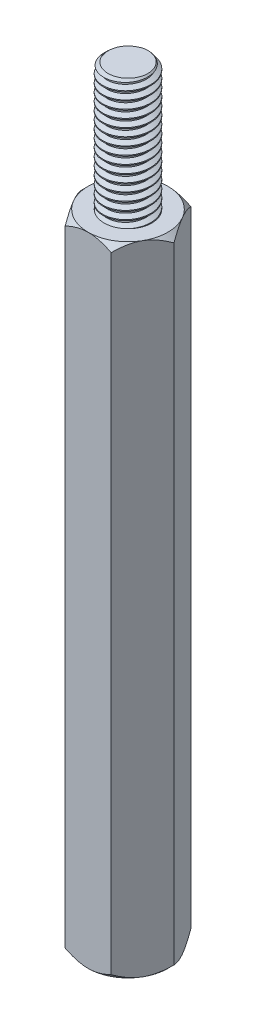
from build123d import *

# Parameters (mm, degrees)
ADJUSTABLE_HEIGHT_DEPTH      = 20
ADJUSTABLE_HEIGHT_DEPTH_BACK = 20
TROU_TARAUD_M31_D            = 2.5
TROU_TARAUD_M31_DEPTH        = 20
TROU_TARAUD_M31_CSINK_D      = 3.5
TROU_TARAUD_M31_CSINK_ANGLE  = 90
TROU_TARAUD_M31_TIP          = 0.751075774
ESQUISSE6_R                  = 1.5
BOSS_EXTRU_1_DEPTH           = 8
CHANFREIN1_SIZE              = 0.25
FILETAGE3_PITCH              = 0.5


with BuildPart() as part:
    # Esquisse1 → Adjustable height (new, two sides: drawn at the far end of the back side and taken through both)
    with BuildSketch(Plane(origin=(0, 0, 0), x_dir=(1, 0, 0), z_dir=(0, 1, 0)).offset(-ADJUSTABLE_HEIGHT_DEPTH_BACK)):
        Polygon((-2.886751346, 0), (-1.443375673, -2.5), (1.443375673, -2.5), (2.886751346, 0), (1.443375673, 2.5), (-1.443375673, 2.5), align=None)
    extrude(amount=ADJUSTABLE_HEIGHT_DEPTH + ADJUSTABLE_HEIGHT_DEPTH_BACK)

    # Trou taraudé M31
    with Locations(Plane(origin=(0, -20, 0), x_dir=(-1, 0, 0), z_dir=(0, -1, 0))):
        with Locations((0, 0)):
            CounterSinkHole(TROU_TARAUD_M31_D / 2, TROU_TARAUD_M31_CSINK_D / 2, depth=TROU_TARAUD_M31_DEPTH, counter_sink_angle=TROU_TARAUD_M31_CSINK_ANGLE)
            with Locations((0, 0, -(TROU_TARAUD_M31_DEPTH + TROU_TARAUD_M31_TIP / 2))):  # 118° drill point
                Cone(0, TROU_TARAUD_M31_D / 2, TROU_TARAUD_M31_TIP, mode=Mode.SUBTRACT)

    # Esquisse5 → Enlèvement de matière-Révolution1 (revolve, cut)
    with BuildSketch(Plane(origin=(0, 0, 0), x_dir=(0, 0, -1), z_dir=(1, 0, 0)), mode=Mode.PRIVATE) as enl_vement_de_mati_re_r_volution1_sk:
        Polygon((-2.5, 20), (-3.5, 19), (-3.5, 20), align=None)
        Polygon((-3.5, -19), (-3.5, -20), (-2.5, -20), align=None)
    revolve(enl_vement_de_mati_re_r_volution1_sk.sketch.rotate(Axis((0, 23.826611975, 0), (0, -1, 0)), 180), axis=Axis((0, 23.826611975, 0), (0, -1, 0)), mode=Mode.SUBTRACT)

    # Esquisse6 → Boss.-Extru.1 (add)
    with BuildSketch(Plane(origin=(0, 20, 0), x_dir=(1, 0, 0), z_dir=(0, 1, 0))):
        with Locations(Location((0, 0, 0), (0, 0, 270))):
            Circle(ESQUISSE6_R)
    extrude(amount=BOSS_EXTRU_1_DEPTH)

    # Chanfrein1
    chanfrein1_edges = [part.edges().sort_by_distance(p)[0] for p in [
        (0, 28, -1.5),
    ]]
    chamfer(chanfrein1_edges, length=CHANFREIN1_SIZE)

    # Filetage3: the profile of Profil de filetage6 profile screwed along a right-hand helix of 17 turns, 6 arcs to a turn; built about Z, then put on its axis
    filetage3_z = Axis((0, 0, 0), (0, 0, 1))
    filetage3_corners = [(1.5003, 0, -0.000173205), (1.5003, 0, 0.437673204), (1.229367063, 0, 0.281249999), (1.229367063, 0, 0.156249999)]
    with BuildLine(mode=Mode.PRIVATE) as filetage3_profile:
        Line(filetage3_corners[0], filetage3_corners[1])
        Line(filetage3_corners[1], filetage3_corners[2])
        Line(filetage3_corners[2], filetage3_corners[3])
        Line(filetage3_corners[3], filetage3_corners[0])
    filetage3_cap = Face(filetage3_profile.wire())
    filetage3_turn_angles = [0, 30, 60, 90, 120, 150, 180, 210, 240, 270, 300, 330, 360]
    filetage3_turn_weights = [1, 0.8660254037844387, 1, 0.8660254037844387, 1, 0.8660254037844387, 1, 0.8660254037844387, 1, 0.8660254037844387, 1, 0.8660254037844387, 1]
    filetage3_turn_rails = [Edge.make_bspline([Vector(p[0], p[1], 0).rotate(filetage3_z, filetage3_turn_angles[k]) / filetage3_turn_weights[k] + Vector(0, 0, p[2] + FILETAGE3_PITCH * filetage3_turn_angles[k] / 360) for k in range(13)], [0, 0, 0, 1, 1, 2, 2, 3, 3, 4, 4, 5, 5, 6, 6, 6], 2, filetage3_turn_weights) for p in filetage3_corners]
    filetage3_turn_sides = [Face.make_surface_from_curves(filetage3_turn_rails[p[0]], filetage3_turn_rails[p[1]]) for p in [(0, 1), (1, 2), (2, 3), (3, 0)]]
    filetage3 = Plane(origin=(0, 28.75, 0), x_dir=(-1, 0, 0), z_dir=(0, -1, 0)) * Solid(Shell([*[p.moved(Location((0, 0, FILETAGE3_PITCH * i))) for i in range(17) for p in filetage3_turn_sides], filetage3_cap, filetage3_cap.rotate(filetage3_z, 6120).moved(Location((0, 0, FILETAGE3_PITCH * 6120 / 360)))]))
    add(filetage3, mode=Mode.SUBTRACT)


solid = part.part
